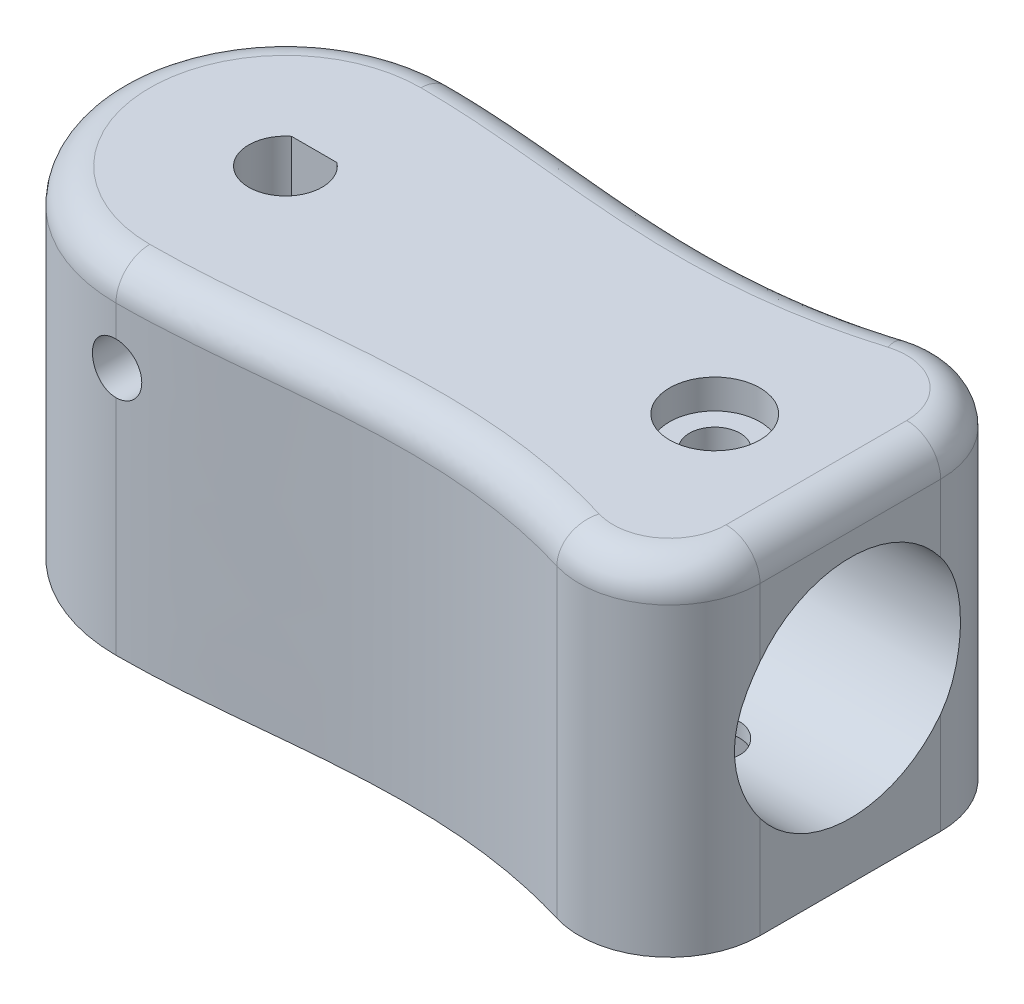
from build123d import *

# Parameters (mm, degrees)
SKETCH1_W                                   = 65
SKETCH1_H                                   = 40
BOSS_EXTRUDE1_DEPTH                         = 30
SKETCH3_R                                   = 10
CUT_EXTRUDE2_DEPTH                          = 35
CBORE_FOR_M4_CHEESE_HEAD_SCREW1_D           = 4.5
CBORE_FOR_M4_CHEESE_HEAD_SCREW1_CBORE_D     = 8
CBORE_FOR_M4_CHEESE_HEAD_SCREW1_CBORE_DEPTH = 2.6
SKETCH10_R                                  = 2.25
CUT_EXTRUDE8_DEPTH                          = 4
CUT_EXTRUDE9_DEPTH                          = 15
CUT_EXTRUDE10_DEPTH                         = 83.006097414
FILLET9_R                                   = 8
SKETCH12_R                                  = 2.25
CUT_EXTRUDE11_DEPTH                         = 8
SKETCH12_3_R                                = 2.25
CUT_EXTRUDE12_DEPTH                         = 79.010807554
FILLET10_R                                  = 3


with BuildPart() as part:
    # Sketch1 → Boss-Extrude1 (new body)
    with BuildSketch(Plane(origin=(0, 0, 0), x_dir=(1, 0, 0), z_dir=(0, 1, 0))):
        with Locations((32.5, 20)):
            Rectangle(SKETCH1_W, SKETCH1_H)
    extrude(amount=BOSS_EXTRUDE1_DEPTH)

    # Sketch3 → Cut-Extrude2 (cut)
    with BuildSketch(Plane(origin=(65, 0, 0), x_dir=(0, 0, -1), z_dir=(1, 0, 0))):
        with Locations((20, 15)):
            Circle(SKETCH3_R)
    extrude(amount=-CUT_EXTRUDE2_DEPTH, mode=Mode.SUBTRACT)

    # CBORE for M4 Cheese Head Screw1 (through all)
    with Locations(Plane(origin=(0, 30, 0), x_dir=(1, 0, 0), z_dir=(0, 1, 0))):
        with Locations((53, 20)):
            CounterBoreHole(CBORE_FOR_M4_CHEESE_HEAD_SCREW1_D / 2, CBORE_FOR_M4_CHEESE_HEAD_SCREW1_CBORE_D / 2, CBORE_FOR_M4_CHEESE_HEAD_SCREW1_CBORE_DEPTH)

    # Sketch10 → Cut-Extrude8 (cut)
    with BuildSketch(Plane.XZ):
        Polygon((53, -15.669872981), (49.25, -17.834936491), (49.25, -22.165063509), (53, -24.330127019), (56.75, -22.165063509), (56.75, -17.834936491), align=None)
        with Locations(Location((53, -20, 0), (0, 0, 90))):
            Circle(SKETCH10_R, mode=Mode.SUBTRACT)
    extrude(amount=-CUT_EXTRUDE8_DEPTH, mode=Mode.SUBTRACT)

    # Sketch2 → Cut-Extrude9 (cut)
    with BuildSketch(Plane(origin=(0, 30, 0), x_dir=(1, 0, 0), z_dir=(0, 1, 0))):
        with BuildLine():
            Line((17.014944168, 22.55), (12.985055832, 22.55))
            ThreePointArc((12.985055832, 22.55), (13.583325822, 17.075015509), (18.25, 20))
            ThreePointArc((18.25, 20), (17.924984491, 21.416674178), (17.014944168, 22.55))
        make_face()
    extrude(amount=-CUT_EXTRUDE9_DEPTH, mode=Mode.SUBTRACT)

    # Sketch2<7> → Cut-Extrude10 (cut, through all)
    with BuildSketch(Plane(origin=(0, 30, 0), x_dir=(1, 0, 0), z_dir=(0, 1, 0))):
        with BuildLine():
            Line((65, 40), (0, 40))
            Line((0, 40), (0, 19.999999921))
            ThreePointArc((0, 19.999999921), (4.393398254, 30.60660169), (15, 35))
            add(Edge.make_bspline(
                [(15, 35), (30.758528256, 35), (45.015961289, 29.236867717), (65, 40)],
                knots=[0, 0, 0, 0, 1, 1, 1, 1], degree=3))
        make_face()
        with BuildLine():
            ThreePointArc((15, 5), (4.39339831, 9.393398254), (0, 19.999999921))
            Line((0, 19.999999921), (0, 0))
            Line((0, 0), (65, 0))
            add(Edge.make_bspline(
                [(15, 5), (30.758528256, 5), (45.015961289, 10.763132283), (65, 0)],
                knots=[0, 0, 0, 0, 1, 1, 1, 1], degree=3))
        make_face()
    extrude(amount=-CUT_EXTRUDE10_DEPTH, mode=Mode.SUBTRACT)

    # Fillet9
    # the kernel refuses this fillet: 8 mm, written as the material it takes off along each edge
    with BuildSketch(Plane(origin=(65, 0, -40), x_dir=(0, 0, 1), z_dir=(0, 1, 0))) as fillet9_piece_1:
        with BuildLine():
            CenterArc((12.0050638, -8), FILLET9_R, 90, 106.898701243)
            Line((4.350502414, -10.325444039), (4.197411186, -10.37195292))
            ThreePointArc((4.197411186, -10.37195292), (2.285588644, -5.115947892), (-0.140868031, -0.075869611))
            Line((-0.140868031, -0.075869611), (0, 0.16))
            Line((0, 0.16), (12.0050638, 0.16))
            Line((12.0050638, 0.16), (12.0050638, 0))
        make_face()
    extrude(amount=30, mode=Mode.SUBTRACT)
    with BuildSketch(Plane(origin=(65, 0, 0), x_dir=(0, 0, -1), z_dir=(0, 1, 0))) as fillet9_piece_2:
        with BuildLine():
            CenterArc((12.0050638, 8), FILLET9_R, 163.101298757, 106.898701243)
            Line((4.350502414, 10.325444039), (4.197411186, 10.37195292))
            ThreePointArc((4.197411186, 10.37195292), (2.285588644, 5.115947892), (-0.140868031, 0.075869611))
            Line((-0.140868031, 0.075869611), (0, -0.16))
            Line((0, -0.16), (12.0050638, -0.16))
            Line((12.0050638, -0.16), (12.0050638, 0))
        make_face()
    extrude(amount=30, mode=Mode.SUBTRACT)

    # Sketch12 → Cut-Extrude11 (cut)
    # profile 1 of 2: a face of its own
    with BuildSketch(Plane.XY.offset(-35)):
        Polygon((15, 17.727608008), (18.7, 19.863804004), (18.7, 24.136195996), (15, 26.272391992), (11.3, 24.136195996), (11.3, 19.863804004), align=None)
        with Locations((15, 22)):
            Circle(SKETCH12_R, mode=Mode.SUBTRACT)
    # profile 2 of 2: a face of its own
    with BuildSketch(Plane.XY.offset(-35)):
        with Locations((15, 22)):
            Circle(SKETCH12_R)
    extrude(amount=CUT_EXTRUDE11_DEPTH, mode=Mode.SUBTRACT)

    # Sketch12<3> → Cut-Extrude12 (cut, through all)
    with BuildSketch(Plane.XY.offset(-35)):
        with Locations(Location((15, 22, 0), (0, 0, 153.576683422))):
            Circle(SKETCH12_3_R)
    extrude(amount=CUT_EXTRUDE12_DEPTH, mode=Mode.SUBTRACT)

    # Fillet10
    fillet10_edges = [part.edges().sort_by_distance(p)[0] for p in [
        (0, 30, -20),
        (34.916790613, 30, -33.583596944),
        (34.916790613, 30, -6.416403056),
        (65, 30, -20),
        (61.7642653, 30, -34.421581993),
        (61.7642653, 30, -5.578418007),
    ]]
    fillet(fillet10_edges, radius=FILLET10_R)


solid = part.part
